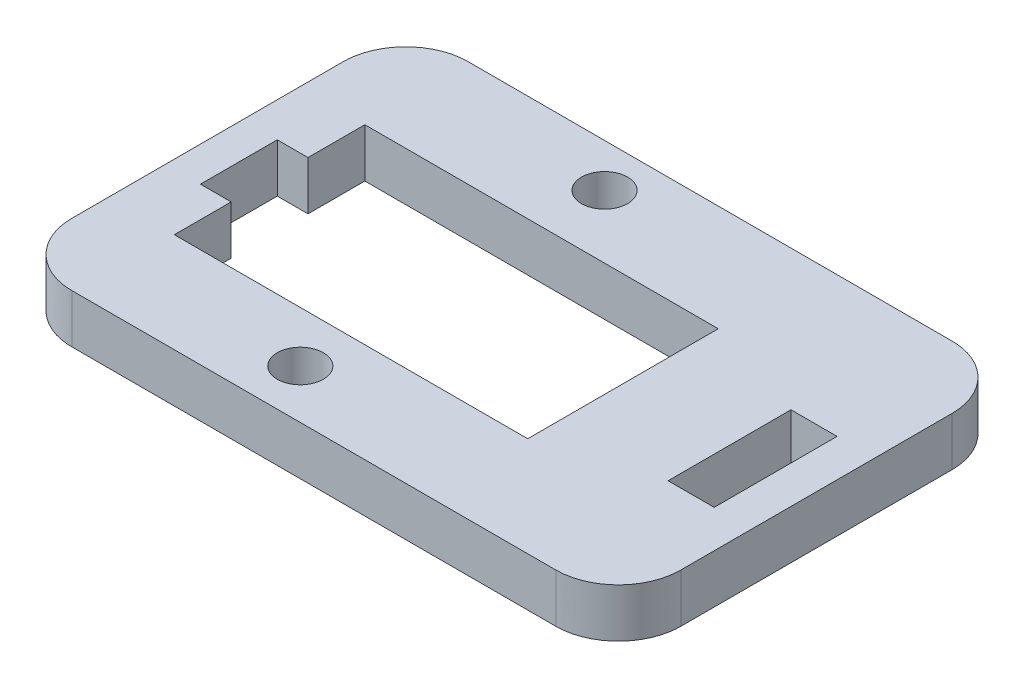
from build123d import *

# Parameters (mm, degrees)
SKETCH1_R           = 1.499950001
SKETCH1_R_2         = 1.499950003
SKETCH1_W           = 3.0001
SKETCH1_H           = 8
BOSS_EXTRUDE1_DEPTH = 3.175


with BuildPart() as part:
    # Sketch1 → Boss-Extrude1 (new body)
    with BuildSketch(Plane(origin=(0, 0, 0), x_dir=(1, 0, 0), z_dir=(0, 1, 0))):
        with BuildLine():
            Line((-15.7526, 12.89915), (15.7525, 12.89915))
            add(Edge.make_bspline(
                [(15.7525, 12.89915), (17.9896, 12.89915), (19.82, 11.06885), (19.82, 8.83175)],
                knots=[0.111111111, 0.111111111, 0.111111111, 0.111111111, 0.222222222, 0.222222222, 0.222222222, 0.222222222], degree=3))
            Line((19.82, 8.83175), (19.82, -8.83175))
            add(Edge.make_bspline(
                [(19.82, -8.83175), (19.82, -11.06885), (17.9896, -12.89915), (15.7525, -12.89915)],
                knots=[0.333333333, 0.333333333, 0.333333333, 0.333333333, 0.444444444, 0.444444444, 0.444444444, 0.444444444], degree=3))
            Line((15.7525, -12.89915), (-15.7526, -12.89915))
            add(Edge.make_bspline(
                [(-15.7526, -12.89915), (-17.9897, -12.89915), (-19.82, -11.06885), (-19.82, -8.83175)],
                knots=[0.555555556, 0.555555556, 0.555555556, 0.555555556, 0.666666667, 0.666666667, 0.666666667, 0.666666667], degree=3))
            Line((-19.82, -8.83175), (-19.82, 8.83175))
            add(Edge.make_bspline(
                [(-19.82, 8.83175), (-19.82, 11.06885), (-17.9897, 12.89915), (-15.7526, 12.89915)],
                knots=[0.777777778, 0.777777778, 0.777777778, 0.777777778, 1, 1, 1, 1], degree=3))
        make_face()
        with Locations((-4.06125, 10.0836)):
            Circle(SKETCH1_R, mode=Mode.SUBTRACT)
        with Locations((-4.06191002, -9.716349978)):
            Circle(SKETCH1_R_2, mode=Mode.SUBTRACT)
        Polygon((-15.5612, 5.98375), (7.4388, 5.98375), (7.4388, -6.41625), (-15.5612, -6.41625), (-15.5612, -2.71635), (-17.5613, -2.71635), (-17.5613, 2.28365), (-15.5612, 2.28365), align=None, mode=Mode.SUBTRACT)
        with Locations((15.87435, -0.21635)):
            Rectangle(SKETCH1_W, SKETCH1_H, mode=Mode.SUBTRACT)
    extrude(amount=BOSS_EXTRUDE1_DEPTH)


solid = part.part
